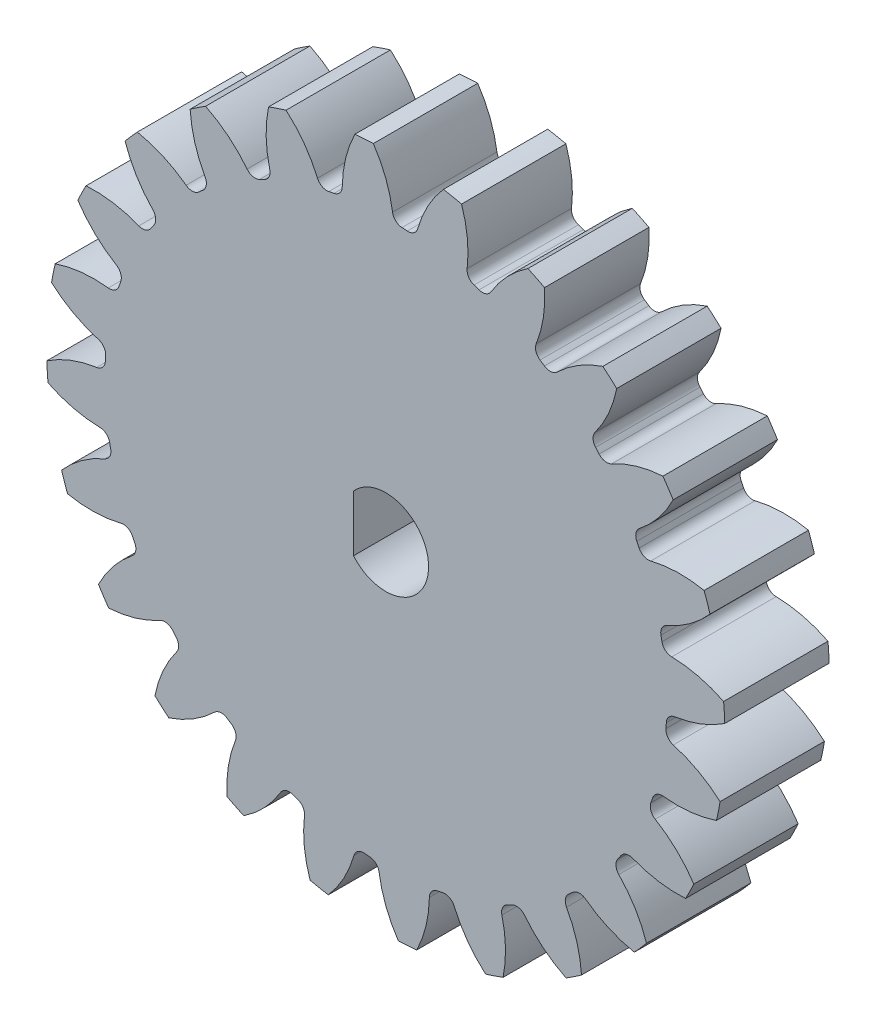
from build123d import *

# Parameters (mm, degrees)
SKETCH3_R          = 20.6375
GEARBODY_DEPTH     = 6.35
TOOTHCUT_DEPTH     = 30.868634259
CIRPATTERN1_COUNT  = 24
CUT_EXTRUDE1_DEPTH = 30.849477941


with BuildPart() as part:
    # Sketch3 → gearBody (new body)
    with BuildSketch(Plane.XY):
        Circle(SKETCH3_R)
    extrude(amount=GEARBODY_DEPTH)

    # Sketch2 → toothCut (cut, through all)
    with BuildSketch(Plane.XY):
        with BuildLine():
            ThreePointArc((17.04439181, -1.303986765), (17.05590718, -1.14354882), (17.065912391, -0.983009622))
            ThreePointArc((17.065912391, -0.983009622), (17.226475942, -0.603092534), (17.591114308, -0.410332293))
            ThreePointArc((17.591114308, -0.410332293), (20.42378314, 0.626979823), (22.599606758, 2.716434472))
            ThreePointArc((22.599606758, 2.716434472), (22.711286815, -1.522725526), (22.034703624, -5.709034773))
            ThreePointArc((22.034703624, -5.709034773), (20.157284273, -3.347822008), (17.488443939, -1.941649751))
            ThreePointArc((17.488443939, -1.941649751), (17.152801577, -1.701937731), (17.04439181, -1.303986765))
        make_face()
    toothcut = extrude(amount=TOOTHCUT_DEPTH, mode=Mode.SUBTRACT)

    # CirPattern1: toothCut ×24 about axis
    cirpattern1_axis = Axis((0, 0, 6.35), (0, 0, -1))
    for i in range(1, CIRPATTERN1_COUNT):
        add(toothcut.rotate(cirpattern1_axis, i * 360 / CIRPATTERN1_COUNT), mode=Mode.SUBTRACT)

    # Sketch4 → Cut-Extrude1 (cut, through all)
    with BuildSketch(Plane(origin=(0, 0, 0), x_dir=(-1, 0, 0), z_dir=(0, 0, -1))):
        with BuildLine():
            Line((1.9685, -1.703883799), (1.9685, 1.703883799))
            ThreePointArc((1.9685, 1.703883799), (-2.6035, 0), (1.9685, -1.703883799))
        make_face()
    extrude(amount=-CUT_EXTRUDE1_DEPTH, mode=Mode.SUBTRACT)


solid = part.part
